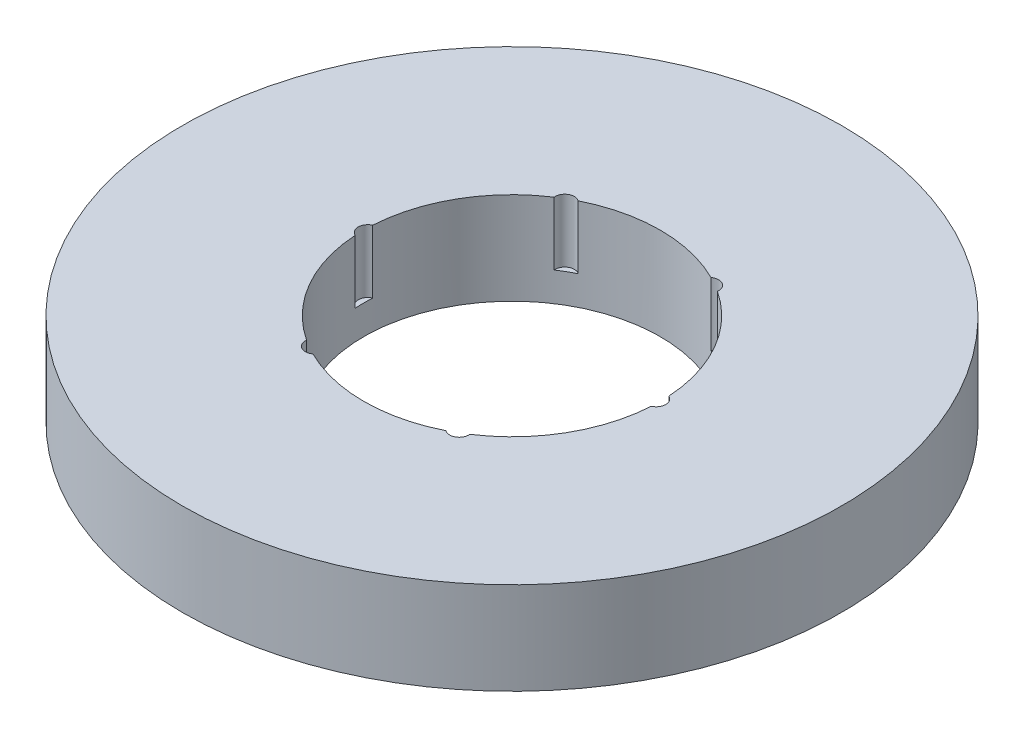
from build123d import *

# Parameters (mm, degrees)
SKETCH1_R           = 100
BOSS_EXTRUDE1_DEPTH = 28
SKETCH2_R           = 45
CUT_EXTRUDE1_DEPTH  = 145.166570328
SKETCH3_R           = 2.908245437
CUT_EXTRUDE2_DEPTH  = 19.153096289
CIRPATTERN1_COUNT   = 6


with BuildPart() as part:
    # Sketch1 → Boss-Extrude1 (new body)
    with BuildSketch(Plane(origin=(0, 0, 0), x_dir=(1, 0, 0), z_dir=(0, 1, 0))):
        Circle(SKETCH1_R)
    extrude(amount=BOSS_EXTRUDE1_DEPTH)

    # Sketch2 → Cut-Extrude1 (cut, through all)
    with BuildSketch(Plane(origin=(0, 0, 0), x_dir=(1, 0, 0), z_dir=(0, 1, 0))):
        Circle(SKETCH2_R)
    extrude(amount=CUT_EXTRUDE1_DEPTH, mode=Mode.SUBTRACT)

    # Sketch3 → Cut-Extrude2 (cut)
    with BuildSketch(Plane(origin=(0, 28, 0), x_dir=(1, 0, 0), z_dir=(0, 1, 0))):
        with Locations((-43.752483845, 0)):
            Circle(SKETCH3_R)
    cut_extrude2 = extrude(amount=-CUT_EXTRUDE2_DEPTH, mode=Mode.SUBTRACT)

    # CirPattern1: Cut-Extrude2 ×6 about axis
    cirpattern1_axis = Axis((0, 0, 0), (0, 1, 0))
    for i in range(1, CIRPATTERN1_COUNT):
        add(cut_extrude2.rotate(cirpattern1_axis, i * 360 / CIRPATTERN1_COUNT), mode=Mode.SUBTRACT)


solid = part.part
